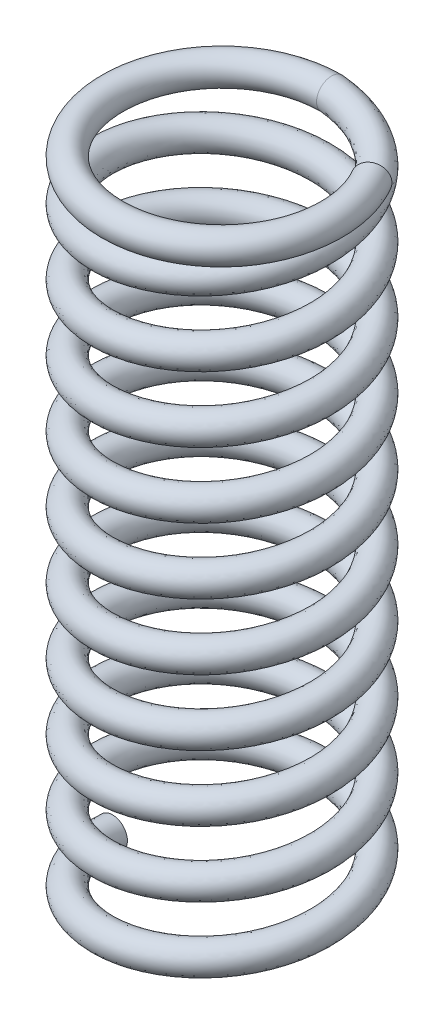
from build123d import *

# Parameters (mm, degrees)
SWEEP2_PITCH       = 8.57025641
SWEEP2_HEIGHT      = 83.56
SWEEP2_RADIUS      = 14.3
SWEEP2_START_ANGLE = -90
SKETCH3_R          = 1.95
SWEEP3_OUTLINE_R   = 1.95
SWEEP3_ANGLE       = 300


# Read off the part's stored shape, not the designer's step: Sweep3
with BuildPart() as part:
    # Sweep2: sweep along a helix
    with BuildLine() as sweep2_path:
        add(Helix(SWEEP2_PITCH, SWEEP2_HEIGHT, SWEEP2_RADIUS, center=(0, 0, 0), direction=(0, 1, 0), mode=Mode.PRIVATE).rotate(Axis((0, 0, 0), (0, 1, 0)), SWEEP2_START_ANGLE))
    # Sketch3 → Sweep2 (sweep)
    with BuildSketch(Plane.XY):
        with Locations((-14.3, 0)):
            Circle(SKETCH3_R)
    sweep(path=sweep2_path.line, is_frenet=True)

    # Sweep3 outline → Sweep3 (revolve)
    with BuildSketch(Plane(origin=(0, 0, 0), x_dir=(0, 0, -1), z_dir=(1, 0, 0))):
        with Locations((14.3, 83.56)):
            Circle(SWEEP3_OUTLINE_R)
    revolve(axis=Axis((0, 0, 0), (0, 1, 0)), revolution_arc=SWEEP3_ANGLE)


solid = part.part
